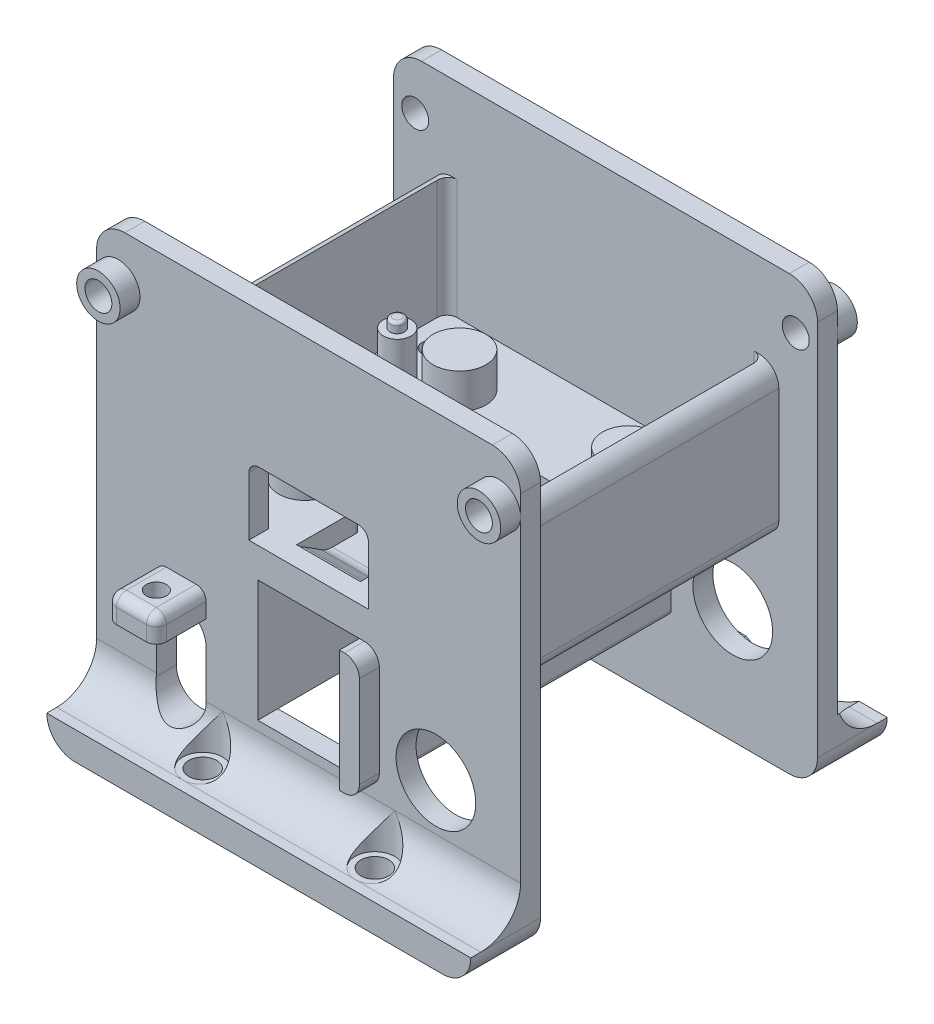
from build123d import *

# Parameters (mm, degrees)
SKETCH_1_W                = 31.8
SKETCH_1_H                = 27.8
EXTRUDE_1_DEPTH           = 3
EXTRUDE_2_DEPTH           = 1.5
SKETCH_5_R                = 1.4
EXTRUDE_3_DEPTH           = 4.5
SKETCH_6_R                = 0.725
EXTRUDE_4_DEPTH           = 1
SKETCH_7_R                = 1
CUT_EXTRUDE_1_DEPTH       = 10
SKETCH_8_R                = 2
CUT_EXTRUDE_2_DEPTH       = 1
FILLET_1_R                = 1
SKETCH_9_R                = 2.65
EXTRUDE_5_DEPTH           = 3.5
FILLET_2_R                = 0.3
CUT_EXTRUDE_8_DEPTH       = 2
CUT_EXTRUDE_9_DEPTH       = 1.5
EXTRUDE_6_DEPTH           = 6.4
FILLET_3_R                = 2
FILLET_5_R                = 1
FILLET_6_R                = 0.4
EXTRUDE_START             = -15
SKETCH_21_W               = 34.8
SKETCH_21_H               = 31.8
EXTRUDE_7_DEPTH           = 15
SKETCH_22_R               = 1.35
EXTRUDE_8_DEPTH           = 2
EXTRUDE_START_2           = -2
SKETCH_24_R               = 1.35
EXTRUDE_9_DEPTH           = 2
CUT_EXTRUDE_10_DEPTH      = 2
EXTRUDE_10_DEPTH          = 29.8
SKETCH_35_W               = 10.2
SKETCH_35_H               = 12.2
CUT_EXTRUDE_14_DEPTH      = 45.903545517
EXTRUDE_START_3           = 5
EXTRUDE_14_DEPTH          = 5
EXTRUDE_15_DEPTH          = 42.56
EXTRUDE_16_DEPTH          = 5
EXTRUDE_17_DEPTH          = 42.56
CUT_EXTRUDE_15_DEPTH      = 49.572918381
CUT_EXTRUDE_15_DEPTH_BACK = 49.572918381
SKETCH_36_R               = 4
SKETCH_37_W               = 5
SKETCH_37_H               = 2.5
EXTRUDE_11_DEPTH          = 5
SKETCH_38_W               = 5
SKETCH_38_H               = 2.5
EXTRUDE_12_DEPTH          = 5
FILLET_7_R                = 1
FILLET_8_R                = 1
EXTRUDE_13_DEPTH          = 2
SKETCH_49_R               = 1.4
CUT_EXTRUDE_17_DEPTH      = 6
SKETCH_51_R               = 10.376352725
CUT_EXTRUDE_18_DEPTH      = 6
SKETCH_52_R               = 1.99
CUT_EXTRUDE_20_DEPTH      = 4
FILLET_10_R               = 1
FILLET_12_R               = 1
SKETCH_42_R               = 1
CUT_EXTRUDE_21_DEPTH      = 4
SKETCH_54_W               = 10.2
SKETCH_54_H               = 12.2
SKETCH_54_R               = 0.8
SKETCH_54_R_2             = 1.8
EXTRUDE_18_DEPTH          = 2
FILLET_13_R               = 1.5
SKETCH_56_R               = 2.172485986
SKETCH_56_R_2             = 1.35
SKETCH_56_R_3             = 2.18
EXTRUDE_19_DEPTH          = 2
EXTRUDE_START_4           = 2
SKETCH_57_R               = 2.18
SKETCH_57_R_2             = 1.35
SKETCH_57_R_3             = 1.346649262
EXTRUDE_20_DEPTH          = 2
FILLET_14_R               = 2


with BuildPart() as part:
    # 草图1 → 凸台-拉伸1 (new body)
    with BuildSketch(Plane(origin=(0, 0, 0), x_dir=(1, 0, 0), z_dir=(0, 1, 0))):
        Rectangle(SKETCH_1_W, SKETCH_1_H)
    extrude(amount=EXTRUDE_1_DEPTH)

    # 草图2 → 凸台-拉伸2 (add)
    with BuildSketch(Plane(origin=(0, 3, 0), x_dir=(1, 0, 0), z_dir=(0, 1, 0))):
        Polygon((-5.35, 5.35), (5.35, 5.35), (5.35, -7.55), (4.35, -7.55), (4.35, 4.35), (-4.35, 4.35), (-4.35, -7.55), (-5.35, -7.55), align=None)
    extrude(amount=EXTRUDE_2_DEPTH)

    # 草图5 → 凸台-拉伸3 (add)
    with BuildSketch(Plane(origin=(0, 3, 0), x_dir=(1, 0, 0), z_dir=(0, 1, 0))):
        with Locations(Location((12.5, 5.5, 0), (0, 0, 270))):
            Circle(SKETCH_5_R)
        with Locations(Location((12.5, -5.5, 0), (0, 0, 90))):
            Circle(SKETCH_5_R)
        with Locations(Location((-12.5, -5.5, 0), (0, 0, 270))):
            Circle(SKETCH_5_R)
        with Locations(Location((-12.5, 5.5, 0), (0, 0, 90))):
            Circle(SKETCH_5_R)
    extrude(amount=EXTRUDE_3_DEPTH)

    # 草图6 → 凸台-拉伸4 (add)
    with BuildSketch(Plane(origin=(0, 7.5, 0), x_dir=(1, 0, 0), z_dir=(0, 1, 0))):
        with Locations(Location((-12.5, -5.5, 0), (0, 0, 270))):
            Circle(SKETCH_6_R)
        with Locations(Location((-12.5, 5.5, 0), (0, 0, 270))):
            Circle(SKETCH_6_R)
        with Locations(Location((12.5, 5.5, 0), (0, 0, 270))):
            Circle(SKETCH_6_R)
        with Locations(Location((12.5, -5.5, 0), (0, 0, 270))):
            Circle(SKETCH_6_R)
    extrude(amount=EXTRUDE_4_DEPTH)

    # 草图7 → 切除-拉伸1 (cut)
    with BuildSketch(Plane(origin=(0, 3, 0), x_dir=(1, 0, 0), z_dir=(0, 1, 0))):
        with Locations(Location((13.5, 10, 0), (0, 0, 270))):
            Circle(SKETCH_7_R)
        with Locations(Location((-13.5, 10, 0), (0, 0, 270))):
            Circle(SKETCH_7_R)
        with Locations(Location((-13.5, -10, 0), (0, 0, 270))):
            Circle(SKETCH_7_R)
        with Locations(Location((13.5, -10, 0), (0, 0, 270))):
            Circle(SKETCH_7_R)
    extrude(amount=-CUT_EXTRUDE_1_DEPTH, mode=Mode.SUBTRACT)

    # 草图8 → 切除-拉伸2 (cut)
    with BuildSketch(Plane.XZ):
        with Locations(Location((-13.5, 10, 0), (0, 0, 270))):
            Circle(SKETCH_8_R)
        with Locations(Location((13.5, 10, 0), (0, 0, 270))):
            Circle(SKETCH_8_R)
        with Locations(Location((13.5, -10, 0), (0, 0, 270))):
            Circle(SKETCH_8_R)
        with Locations(Location((-13.5, -10, 0), (0, 0, 270))):
            Circle(SKETCH_8_R)
    extrude(amount=-CUT_EXTRUDE_2_DEPTH, mode=Mode.SUBTRACT)

    # 圆角1
    fillet_1_edges = [part.edges().sort_by_distance(p)[0] for p in [
        (15.9, 1.5, 13.9),
        (-15.9, 1.5, 13.9),
        (-15.9, 1.5, -13.9),
        (15.9, 1.5, -13.9),
    ]]
    fillet(fillet_1_edges, radius=FILLET_1_R)

    # 草图9 → 凸台-拉伸5 (add)
    with BuildSketch(Plane(origin=(0, 3, 0), x_dir=(1, 0, 0), z_dir=(0, 1, 0))):
        with Locations(Location((8.5, 7.75, 0), (0, 0, 270))):
            Circle(SKETCH_9_R)
        with Locations(Location((-8.5, 7.75, 0), (0, 0, 90))):
            Circle(SKETCH_9_R)
        with Locations(Location((-8.5, -7.75, 0), (0, 0, 270))):
            Circle(SKETCH_9_R)
        with Locations(Location((8.5, -7.75, 0), (0, 0, 90))):
            Circle(SKETCH_9_R)
    extrude(amount=EXTRUDE_5_DEPTH)

    # 圆角2
    fillet_2_edges = [part.edges().sort_by_distance(p)[0] for p in [
        (-12.5, 8.5, 4.775),
        (-12.5, 8.5, -6.225),
        (12.5, 8.5, -6.225),
        (12.5, 8.5, 4.775),
    ]]
    fillet(fillet_2_edges, radius=FILLET_2_R)

    # 草图15 → 切除-拉伸8 (cut)
    with BuildSketch(Plane(origin=(0, 3, 0), x_dir=(1, 0, 0), z_dir=(0, 1, 0))):
        Polygon((-4.35, 4.35), (4.35, 4.35), (4.35, -7.55), (3.2, -7.55), (3.2, -13.9), (-3.2, -13.9), (-3.2, -7.55), (-4.35, -7.55), align=None)
    extrude(amount=-CUT_EXTRUDE_8_DEPTH, mode=Mode.SUBTRACT)

    # 草图17 → 切除-拉伸9 (cut)
    with BuildSketch(Plane(origin=(0, 4.5, 0), x_dir=(1, 0, 0), z_dir=(0, 1, 0))):
        Polygon((-4.35, -7.55), (-4.35, 4.35), (4.35, 4.35), (4.35, -7.55), (5.35, -7.55), (5.35, 5.35), (-5.35, 5.35), (-5.35, -7.55), align=None)
    extrude(amount=-CUT_EXTRUDE_9_DEPTH, mode=Mode.SUBTRACT)

    # 草图18 → 凸台-拉伸6 (add)
    with BuildSketch(Plane.ZY.offset(-3.2)):
        Polygon((13.9, 1), (10.9, 1), (13.4, 2.6), (13.9, 2.6), align=None)
    extrude(amount=EXTRUDE_6_DEPTH)

    # 圆角3
    fillet_3_edges = [part.edges().sort_by_distance(p)[0] for p in [
        (0, 1, 10.9),
    ]]
    fillet(fillet_3_edges, radius=FILLET_3_R)

    # 圆角5
    fillet_5_edges = [part.edges().sort_by_distance(p)[0] for p in [
        (0, 2.6, 13.4),
    ]]
    fillet(fillet_5_edges, radius=FILLET_5_R)

    # 圆角6
    fillet_6_edges = [part.edges().sort_by_distance(p)[0] for p in [
        (3.2, 2, 7.55),
        (-3.2, 2, 7.55),
    ]]
    fillet(fillet_6_edges, radius=FILLET_6_R)

    # 草图21 → 凸台-拉伸7 (add)
    with BuildSketch(Plane.XZ.offset(EXTRUDE_START)):
        Rectangle(SKETCH_21_W, SKETCH_21_H)
        with BuildLine():
            Line((-14.9, 13.9), (14.9, 13.9))
            ThreePointArc((14.9, 13.9), (15.607106781, 13.607106781), (15.9, 12.9))
            Line((15.9, 12.9), (15.9, -12.9))
            ThreePointArc((15.9, -12.9), (15.607106781, -13.607106781), (14.9, -13.9))
            Line((14.9, -13.9), (-14.9, -13.9))
            ThreePointArc((-14.9, -13.9), (-15.607106781, -13.607106781), (-15.9, -12.9))
            Line((-15.9, -12.9), (-15.9, 12.9))
            ThreePointArc((-15.9, 12.9), (-15.607106781, 13.607106781), (-14.9, 13.9))
        make_face(mode=Mode.SUBTRACT)
    extrude(amount=EXTRUDE_7_DEPTH)

    # 草图22 → 凸台-拉伸8 (add)
    with BuildSketch(Plane.XY.offset(15.9)):
        with BuildLine():
            Line((-21.28, 0), (-21.28, 20.67))
            ThreePointArc((-21.28, 20.67), (-20.451112191, 22.671112191), (-18.45, 23.5))
            Line((-18.45, 23.5), (18.45, 23.5))
            ThreePointArc((18.45, 23.5), (20.451112191, 22.671112191), (21.28, 20.67))
            Line((21.28, 20.67), (21.28, 0))
            Line((21.28, 0), (21.28, -17.17))
            ThreePointArc((21.28, -17.17), (20.451112191, -19.171112191), (18.45, -20))
            Line((18.45, -20), (-18.45, -20))
            ThreePointArc((-18.45, -20), (-20.451112191, -19.171112191), (-21.28, -17.17))
            Line((-21.28, -17.17), (-21.28, 0))
        make_face()
        with Locations((19.1, 18.67)):
            Circle(SKETCH_22_R, mode=Mode.SUBTRACT)
        with Locations(Location((-19.1, 18.67, 0), (0, 0, 180))):
            Circle(SKETCH_22_R, mode=Mode.SUBTRACT)
    extrude(amount=-EXTRUDE_8_DEPTH)

    # 草图24 → 凸台-拉伸9 (add)
    with BuildSketch(Plane(origin=(0, 0, -15.9), x_dir=(-1, 0, 0), z_dir=(0, 0, -1)).offset(EXTRUDE_START_2)):
        with BuildLine():
            Line((-18.45, -20), (18.45, -20))
            ThreePointArc((18.45, -20), (20.451112191, -19.171112191), (21.28, -17.17))
            Line((21.28, -17.17), (21.28, 20.67))
            ThreePointArc((21.28, 20.67), (20.451112191, 22.671112191), (18.45, 23.5))
            Line((18.45, 23.5), (-18.45, 23.5))
            ThreePointArc((-18.45, 23.5), (-20.451112191, 22.671112191), (-21.28, 20.67))
            Line((-21.28, 20.67), (-21.28, -17.17))
            ThreePointArc((-21.28, -17.17), (-20.451112191, -19.171112191), (-18.45, -20))
        make_face()
        with Locations((19.1, 18.67)):
            Circle(SKETCH_24_R, mode=Mode.SUBTRACT)
        with Locations(Location((-19.1, 18.67, 0), (0, 0, 180))):
            Circle(SKETCH_24_R, mode=Mode.SUBTRACT)
    extrude(amount=EXTRUDE_9_DEPTH)

    # 草图25 → 切除-拉伸10 (cut)
    with BuildSketch(Plane.XY.offset(15.9)):
        with BuildLine():
            Line((-5, 9.85), (5, 9.85))
            ThreePointArc((5, 9.85), (5.707106781, 9.557106781), (6, 8.85))
            Line((6, 8.85), (6, 3))
            Line((6, 3), (-6, 3))
            Line((-6, 3), (-6, 8.85))
            ThreePointArc((-6, 8.85), (-5.707106781, 9.557106781), (-5, 9.85))
        make_face()
    extrude(amount=-CUT_EXTRUDE_10_DEPTH, mode=Mode.SUBTRACT)

    # 草图27 → 凸台-拉伸10 (add)
    with BuildSketch(Plane.XY.offset(15.9)):
        with BuildLine():
            Line((-5.1, 0), (-5.1, -12.2))
            Line((-5.1, -12.2), (-6.1, -12.2))
            ThreePointArc((-6.1, -12.2), (-6.453553391, -12.053553391), (-6.6, -11.7))
            Line((-6.6, -11.7), (-6.6, 0))
            Line((-6.6, 0), (-5.1, 0))
        make_face()
        with BuildLine():
            Line((5.1, 0), (5.1, -12.2))
            Line((5.1, -12.2), (6.1, -12.2))
            ThreePointArc((6.1, -12.2), (6.453553391, -12.053553391), (6.6, -11.7))
            Line((6.6, -11.7), (6.6, 0))
            Line((6.6, 0), (5.1, 0))
        make_face()
    extrude(amount=-EXTRUDE_10_DEPTH)

    # 草图35 → 切除-拉伸14 (cut, through all)
    with BuildSketch(Plane.XY.offset(15.9)):
        with Locations((0, -6.1)):
            Rectangle(SKETCH_35_W, SKETCH_35_H)
    extrude(amount=-CUT_EXTRUDE_14_DEPTH, mode=Mode.SUBTRACT)

    # 草图43 → 凸台-拉伸14 (add)
    with BuildSketch(Plane.XY.offset(15.9).offset(EXTRUDE_START_3)):
        with BuildLine():
            Line((-21.28, -17.17), (21.28, -17.17))
            ThreePointArc((21.28, -17.17), (20.451112191, -19.171112191), (18.45, -20))
            Line((18.45, -20), (-18.45, -20))
            ThreePointArc((-18.45, -20), (-20.451112191, -19.171112191), (-21.28, -17.17))
        make_face()
    extrude(amount=-EXTRUDE_14_DEPTH)

    # 草图44 → 凸台-拉伸15 (add)
    with BuildSketch(Plane.ZY.offset(21.28)):
        with BuildLine():
            Line((15.9, -13.17), (15.9, -17.17))
            Line((15.9, -17.17), (19.9, -17.17))
            ThreePointArc((19.9, -17.17), (17.071572875, -15.998427125), (15.9, -13.17))
        make_face()
    extrude(amount=-EXTRUDE_15_DEPTH)

    # 草图45 → 凸台-拉伸16 (add)
    with BuildSketch(Plane(origin=(0, 0, -15.9), x_dir=(-1, 0, 0), z_dir=(0, 0, -1))):
        with BuildLine():
            Line((-18.45, -20), (18.45, -20))
            ThreePointArc((18.45, -20), (20.451112191, -19.171112191), (21.28, -17.17))
            Line((21.28, -17.17), (-21.28, -17.17))
            ThreePointArc((-21.28, -17.17), (-20.451112191, -19.171112191), (-18.45, -20))
        make_face()
    extrude(amount=EXTRUDE_16_DEPTH)

    # 草图46 → 凸台-拉伸17 (add)
    with BuildSketch(Plane(origin=(21.28, 0, 0), x_dir=(0, 0, -1), z_dir=(1, 0, 0))):
        with BuildLine():
            Line((15.9, -13.17), (15.9, -17.17))
            Line((15.9, -17.17), (19.9, -17.17))
            ThreePointArc((19.9, -17.17), (17.071572875, -15.998427125), (15.9, -13.17))
        make_face()
    extrude(amount=-EXTRUDE_17_DEPTH)

    # 草图36 → 切除-拉伸15 (cut, two sides: drawn at the far end of the back side and taken through both)
    with BuildSketch(Plane.XY.offset(15.9).offset(-CUT_EXTRUDE_15_DEPTH_BACK)):
        with Locations((12.78, -8.481512125)):
            Circle(SKETCH_36_R)
        with BuildLine():
            Line((-15.28, -8.481512125), (-15.28, -13.481512125))
            ThreePointArc((-15.28, -13.481512125), (-12.78, -15.981512125), (-10.28, -13.481512125))
            Line((-10.28, -13.481512125), (-10.28, -8.481512125))
            ThreePointArc((-10.28, -8.481512125), (-12.78, -5.981512125), (-15.28, -8.481512125))
        make_face()
    extrude(amount=CUT_EXTRUDE_15_DEPTH + CUT_EXTRUDE_15_DEPTH_BACK, mode=Mode.SUBTRACT)

    # 草图37 → 凸台-拉伸11 (add)
    with BuildSketch(Plane.XY.offset(15.9)):
        with Locations((-12.78, -4.731512125)):
            Rectangle(SKETCH_37_W, SKETCH_37_H)
    extrude(amount=EXTRUDE_11_DEPTH)

    # 草图38 → 凸台-拉伸12 (add)
    with BuildSketch(Plane(origin=(0, 0, -15.9), x_dir=(-1, 0, 0), z_dir=(0, 0, -1))):
        with Locations((12.78, -4.731512125)):
            Rectangle(SKETCH_38_W, SKETCH_38_H)
    extrude(amount=EXTRUDE_12_DEPTH)

    # 圆角7
    fillet_7_edges = [part.edges().sort_by_distance(p)[0] for p in [
        (-15.28, -4.731512125, 20.9),
        (-10.28, -4.731512125, 20.9),
    ]]
    fillet(fillet_7_edges, radius=FILLET_7_R)

    # 圆角8
    fillet_8_edges = [part.edges().sort_by_distance(p)[0] for p in [
        (-10.28, -4.731512125, -20.9),
        (-15.28, -4.731512125, -20.9),
    ]]
    fillet(fillet_8_edges, radius=FILLET_8_R)

    # 草图41 → 凸台-拉伸13 (add)
    with BuildSketch(Plane.XY.offset(15.9)):
        with BuildLine():
            Line((5.1, 0), (5.6, 0))
            ThreePointArc((5.6, 0), (6.660660172, -0.439339828), (7.1, -1.5))
            Line((7.1, -1.5), (7.1, -10.7))
            ThreePointArc((7.1, -10.7), (6.660660172, -11.760660172), (5.6, -12.2))
            Line((5.6, -12.2), (5.1, -12.2))
            Line((5.1, -12.2), (5.1, 0))
        make_face()
    extrude(amount=EXTRUDE_13_DEPTH)

    # 草图49 → 切除-拉伸17 (cut)
    with BuildSketch(Plane.XZ.offset(20)):
        with Locations((-8.64, 17.89)):
            Circle(SKETCH_49_R)
        with Locations((8.64, 17.89)):
            Circle(SKETCH_49_R)
        with Locations((8.64, -17.89)):
            Circle(SKETCH_49_R)
        with Locations((-8.64, -17.89)):
            Circle(SKETCH_49_R)
    extrude(amount=-CUT_EXTRUDE_17_DEPTH, mode=Mode.SUBTRACT)

    # 草图51 → 切除-拉伸18 (cut)
    with BuildSketch(Plane(origin=(0, 0, -15.9), x_dir=(-1, 0, 0), z_dir=(0, 0, -1))):
        with Locations((-12.78, -8.481512125)):
            Circle(SKETCH_51_R)
    extrude(amount=CUT_EXTRUDE_18_DEPTH, mode=Mode.SUBTRACT)

    # 草图52 → 切除-拉伸20 (cut)
    with BuildSketch(Plane(origin=(0, -17.17, 0), x_dir=(1, 0, 0), z_dir=(0, 1, 0))):
        with Locations(Location((-8.64, -17.89, 0), (0, 0, 90))):
            Circle(SKETCH_52_R)
        with Locations(Location((-8.64, 17.89, 0), (0, 0, 270))):
            Circle(SKETCH_52_R)
        with Locations(Location((8.64, -17.89, 0), (0, 0, 90))):
            Circle(SKETCH_52_R)
    extrude(amount=CUT_EXTRUDE_20_DEPTH, mode=Mode.SUBTRACT)

    # 圆角10
    fillet_10_edges = [part.edges().sort_by_distance(p)[0] for p in [
        (-12.78, -3.481512125, 20.9),
        (-15.28, -3.481512125, 17.9),
        (-10.28, -3.481512125, 17.9),
        (-14.987106781, -3.481512125, 20.607106781),
        (-10.572893219, -3.481512125, 20.607106781),
    ]]
    fillet(fillet_10_edges, radius=FILLET_10_R)

    # 圆角12
    fillet_12_edges = [part.edges().sort_by_distance(p)[0] for p in [
        (-12.78, -3.481512125, -20.9),
        (-10.28, -3.481512125, -17.9),
        (-15.28, -3.481512125, -17.9),
        (-14.987106781, -3.481512125, -20.607106781),
        (-10.572893219, -3.481512125, -20.607106781),
    ]]
    fillet(fillet_12_edges, radius=FILLET_12_R)

    # 草图42 → 切除-拉伸21 (cut)
    with BuildSketch(Plane(origin=(0, -3.481512125, 0), x_dir=(1, 0, 0), z_dir=(0, 1, 0))):
        with Locations(Location((-12.78, -18.4, 0), (0, 0, 270))):
            Circle(SKETCH_42_R)
        with Locations(Location((-12.78, 18.4, 0), (0, 0, 270))):
            Circle(SKETCH_42_R)
    extrude(amount=-CUT_EXTRUDE_21_DEPTH, mode=Mode.SUBTRACT)

    # 草图54 → 凸台-拉伸18 (add)
    with BuildSketch(Plane(origin=(0, 0, -6.3), x_dir=(-1, 0, 0), z_dir=(0, 0, -1))):
        with Locations((0, -6.1)):
            Rectangle(SKETCH_54_W, SKETCH_54_H)
        with Locations((0, -1.6)):
            Circle(SKETCH_54_R, mode=Mode.SUBTRACT)
        with Locations((0, -10.6)):
            Circle(SKETCH_54_R, mode=Mode.SUBTRACT)
        with Locations((0, -6.1)):
            Circle(SKETCH_54_R_2, mode=Mode.SUBTRACT)
    extrude(amount=EXTRUDE_18_DEPTH)

    # 圆角13
    fillet_13_edges = [part.edges().sort_by_distance(p)[0] for p in [
        (-17.4, 0, 0),
        (17.4, 0, 0),
    ]]
    fillet(fillet_13_edges, radius=FILLET_13_R)

    # 草图56 → 凸台-拉伸19 (add)
    # profile 1 of 2: a face of its own
    with BuildSketch(Plane(origin=(0, 0, -15.9), x_dir=(-1, 0, 0), z_dir=(0, 0, -1))):
        with Locations((19.1, 18.67)):
            Circle(SKETCH_56_R)
        with Locations((19.1, 18.67)):
            Circle(SKETCH_56_R_2, mode=Mode.SUBTRACT)
    # profile 2 of 2: a face of its own
    with BuildSketch(Plane(origin=(0, 0, -15.9), x_dir=(-1, 0, 0), z_dir=(0, 0, -1))):
        with Locations(Location((-19.1, 18.67, 0), (0, 0, 180))):
            Circle(SKETCH_56_R_3)
        with Locations(Location((-19.1, 18.67, 0), (0, 0, 180))):
            Circle(SKETCH_56_R_2, mode=Mode.SUBTRACT)
    extrude(amount=EXTRUDE_19_DEPTH)

    # 草图57 → 凸台-拉伸20 (add)
    # profile 1 of 2: a face of its own
    with BuildSketch(Plane.XY.offset(15.9).offset(EXTRUDE_START_4)):
        with Locations(Location((-19.1, 18.67, 0), (0, 0, 180))):
            Circle(SKETCH_57_R)
        with Locations((-19.1, 18.67)):
            Circle(SKETCH_57_R_2, mode=Mode.SUBTRACT)
    # profile 2 of 2: a face of its own
    with BuildSketch(Plane.XY.offset(15.9).offset(EXTRUDE_START_4)):
        with Locations((19.1, 18.67)):
            Circle(SKETCH_57_R)
        with Locations((19.1, 18.67)):
            Circle(SKETCH_57_R_3, mode=Mode.SUBTRACT)
    extrude(amount=-EXTRUDE_20_DEPTH)

    # 圆角14
    # the kernel refuses this fillet: 2 mm, written as the material it takes off along each edge
    with BuildSketch(Plane(origin=(-17.4, 15, -13.9), x_dir=(0, -1, 0), z_dir=(0, 0, 1))) as fillet_14_piece_1:
        with BuildLine():
            CenterArc((FILLET_14_R, FILLET_14_R), FILLET_14_R, 180, 90)
            Line((0, FILLET_14_R), (0, 0))
            Line((0, 0), (FILLET_14_R, 0))
        make_face()
    extrude(amount=27.8, mode=Mode.SUBTRACT)
    with BuildSketch(Plane(origin=(17.4, 15, 13.9), x_dir=(-1, 0, 0), z_dir=(0, 0, -1))) as fillet_14_piece_2:
        with BuildLine():
            CenterArc((FILLET_14_R, -FILLET_14_R), FILLET_14_R, 90, 90)
            Line((0, -FILLET_14_R), (0, 0))
            Line((0, 0), (FILLET_14_R, 0))
        make_face()
    extrude(amount=27.8, mode=Mode.SUBTRACT)


solid = part.part
